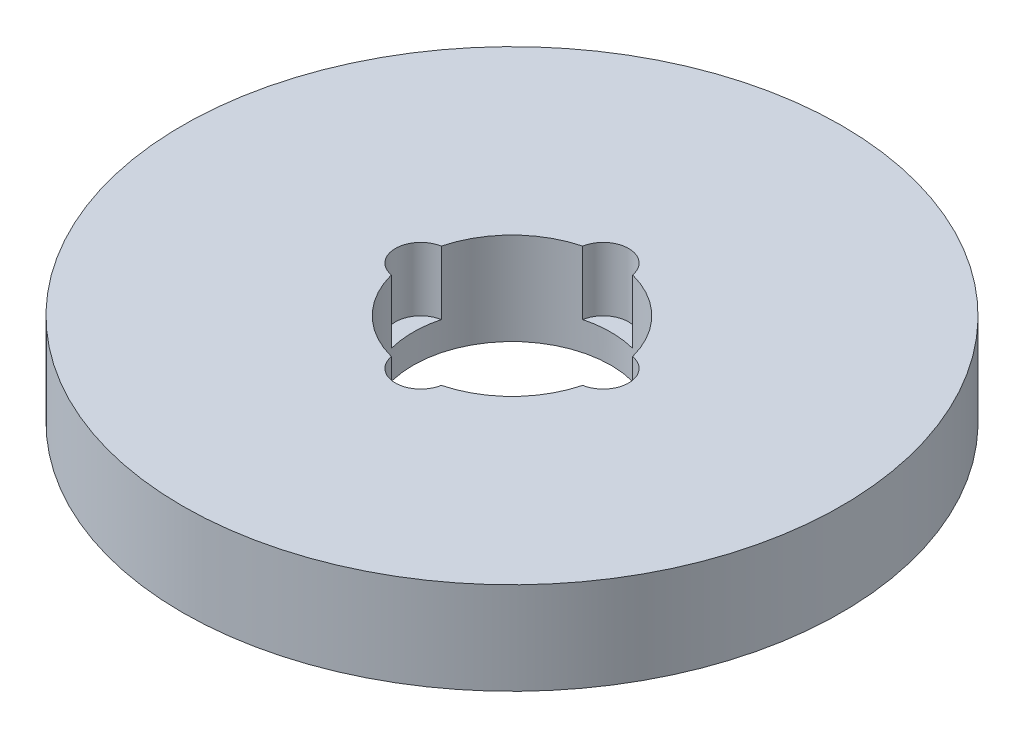
from build123d import *

# Parameters (mm, degrees)
SKETCH1_R           = 25
BOSS_EXTRUDE1_DEPTH = 7
SKETCH2_R           = 7.5
CUT_EXTRUDE1_DEPTH  = 37.041642582
SKETCH3_R           = 1.922442869
CUT_EXTRUDE2_DEPTH  = 4.826156053
CIRPATTERN1_COUNT   = 4


with BuildPart() as part:
    # Sketch1 → Boss-Extrude1 (new body)
    with BuildSketch(Plane(origin=(0, 0, 0), x_dir=(1, 0, 0), z_dir=(0, 1, 0))):
        Circle(SKETCH1_R)
    extrude(amount=BOSS_EXTRUDE1_DEPTH)

    # Sketch2 → Cut-Extrude1 (cut, through all)
    with BuildSketch(Plane(origin=(0, 0, 0), x_dir=(1, 0, 0), z_dir=(0, 1, 0))):
        Circle(SKETCH2_R)
    extrude(amount=CUT_EXTRUDE1_DEPTH, mode=Mode.SUBTRACT)

    # Sketch3 → Cut-Extrude2 (cut)
    with BuildSketch(Plane(origin=(0, 7, 0), x_dir=(1, 0, 0), z_dir=(0, 1, 0))):
        with Locations((-6.922121964, 0)):
            Circle(SKETCH3_R)
    cut_extrude2 = extrude(amount=-CUT_EXTRUDE2_DEPTH, mode=Mode.SUBTRACT)

    # CirPattern1: Cut-Extrude2 ×4 about axis
    cirpattern1_axis = Axis((0, 0, 0), (0, 1, 0))
    for i in range(1, CIRPATTERN1_COUNT):
        add(cut_extrude2.rotate(cirpattern1_axis, i * 360 / CIRPATTERN1_COUNT), mode=Mode.SUBTRACT)


solid = part.part
